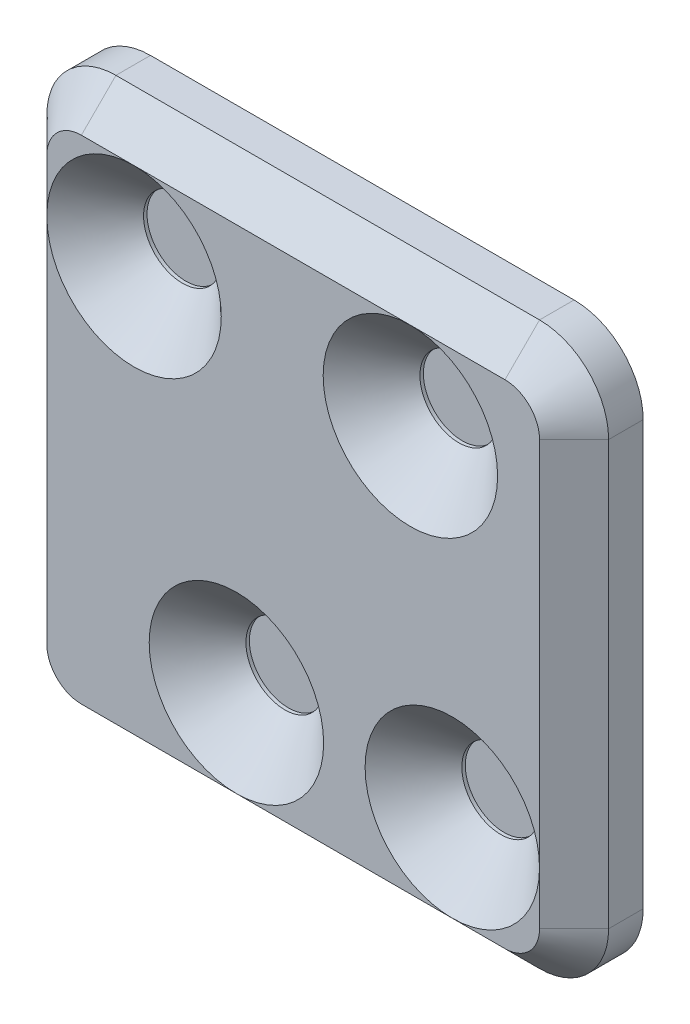
from build123d import *

# Parameters (mm, degrees)
SKETCH1_W           = 32.526911934
SKETCH1_H           = 32.526911934
BOSS_EXTRUDE1_DEPTH = 4
FILLET1_R           = 4
CHAMFER1_SIZE       = 2
SKETCH2_R           = 2.25
CUT_EXTRUDE1_DEPTH  = 3
CHAMFER2_SIZE       = 2.8


with BuildPart() as part:
    # Sketch1 → Boss-Extrude1 (new body)
    with BuildSketch(Plane.XY):
        Rectangle(SKETCH1_W, SKETCH1_H)
    extrude(amount=BOSS_EXTRUDE1_DEPTH)

    # Fillet1
    fillet1_edges = [part.edges().sort_by_distance(p)[0] for p in [
        (-16.263455967, 16.263455967, 2),
        (16.263455967, 16.263455967, 2),
        (16.263455967, -16.263455967, 2),
        (-16.263455967, -16.263455967, 2),
    ]]
    fillet(fillet1_edges, radius=FILLET1_R)

    # Chamfer1
    chamfer1_edges = [part.edges().sort_by_distance(p)[0] for p in [
        (0, -16.263455967, 4),
        (-16.263455967, 0, 4),
        (16.263455967, 0, 4),
        (0, 16.263455967, 4),
        (-15.091883092, 15.091883092, 4),
        (15.091883092, 15.091883092, 4),
        (15.091883092, -15.091883092, 4),
        (-15.091883092, -15.091883092, 4),
    ]]
    chamfer(chamfer1_edges, length=CHAMFER1_SIZE)

    # Sketch2 → Cut-Extrude1 (cut)
    with BuildSketch(Plane.XY.offset(4)):
        with Locations((-9.213455967, 9.213455967)):
            Circle(SKETCH2_R)
        with Locations((9.213455967, -9.213455967)):
            Circle(SKETCH2_R)
        with Locations((-3.286544033, -9.213455967)):
            Circle(SKETCH2_R)
        with Locations((6.786544033, 9.213455967)):
            Circle(SKETCH2_R)
    extrude(amount=-CUT_EXTRUDE1_DEPTH, mode=Mode.SUBTRACT)

    # Chamfer2
    chamfer2_edges = [part.edges().sort_by_distance(p)[0] for p in [
        (-11.463455967, 9.213455967, 4),
        (6.963455967, -9.213455967, 4),
        (-5.536544033, -9.213455967, 4),
        (4.536544033, 9.213455967, 4),
    ]]
    chamfer(chamfer2_edges, length=CHAMFER2_SIZE - 0.0001)  # a hair under: the kernel refuses the full size


solid = part.part
